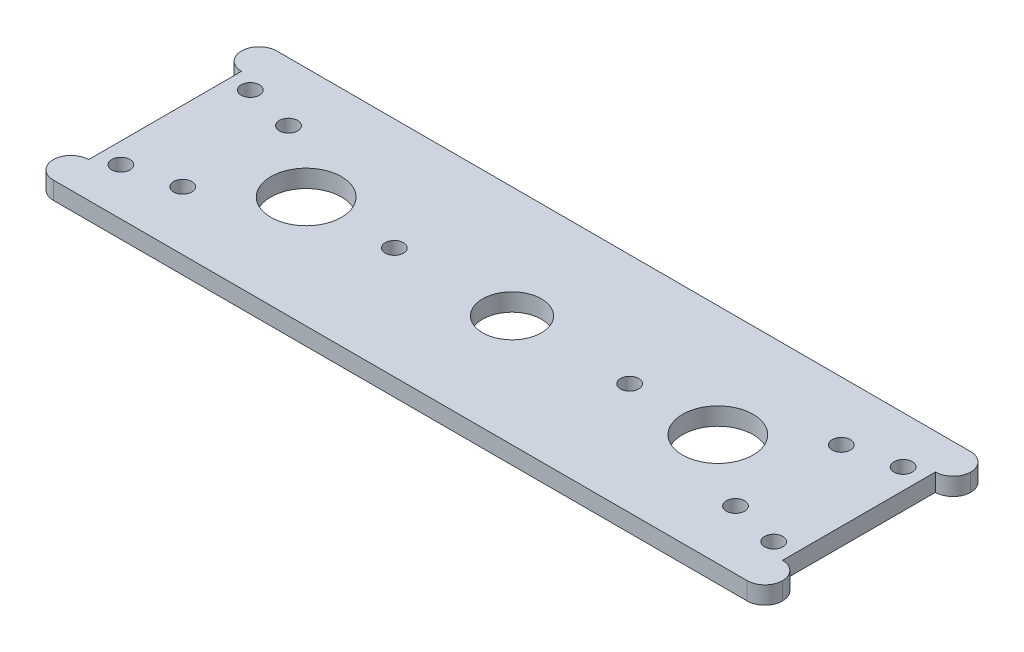
from build123d import *

# Parameters (mm, degrees)
SKETCH1_R           = 1.55
SKETCH1_R_2         = 5
SKETCH1_R_3         = 6
BOSS_EXTRUDE1_DEPTH = 3
FILLET1_R           = 3


with BuildPart() as part:
    # Sketch1 → Boss-Extrude1 (new body)
    with BuildSketch(Plane(origin=(0, 0, 0), x_dir=(1, 0, 0), z_dir=(0, 1, 0))):
        Polygon((-62, 19), (62, 19), (62, 13), (59, 13), (59, -13), (62, -13), (62, -19), (-62, -19), (-62, -13), (-59, -13), (-59, 13), (-62, 13), align=None)
        with Locations(Location((55.5, 11, 0), (0, 0, 270))):
            Circle(SKETCH1_R, mode=Mode.SUBTRACT)
        with Locations(Location((-55.5, 11, 0), (0, 0, 90))):
            Circle(SKETCH1_R, mode=Mode.SUBTRACT)
        with Locations(Location((-55.5, -11, 0), (0, 0, 270))):
            Circle(SKETCH1_R, mode=Mode.SUBTRACT)
        with Locations(Location((55.5, -11, 0), (0, 0, 90))):
            Circle(SKETCH1_R, mode=Mode.SUBTRACT)
        with Locations(Location((0, 0, 0), (0, 0, 270))):
            Circle(SKETCH1_R_2, mode=Mode.SUBTRACT)
        with Locations(Location((20, 0, 0), (0, 0, 270))):
            Circle(SKETCH1_R, mode=Mode.SUBTRACT)
        with Locations(Location((-20, 0, 0), (0, 0, 90))):
            Circle(SKETCH1_R, mode=Mode.SUBTRACT)
        with Locations(Location((35, 0, 0), (0, 0, 270))):
            Circle(SKETCH1_R_3, mode=Mode.SUBTRACT)
        with Locations(Location((-35, 0, 0), (0, 0, 90))):
            Circle(SKETCH1_R_3, mode=Mode.SUBTRACT)
        with Locations(Location((47, 9, 0), (0, 0, 270))):
            Circle(SKETCH1_R, mode=Mode.SUBTRACT)
        with Locations(Location((47, -9, 0), (0, 0, 90))):
            Circle(SKETCH1_R, mode=Mode.SUBTRACT)
        with Locations(Location((-47, -9, 0), (0, 0, 270))):
            Circle(SKETCH1_R, mode=Mode.SUBTRACT)
        with Locations(Location((-47, 9, 0), (0, 0, 90))):
            Circle(SKETCH1_R, mode=Mode.SUBTRACT)
    extrude(amount=BOSS_EXTRUDE1_DEPTH)

    # Fillet1
    fillet1_edges = [part.edges().sort_by_distance(p)[0] for p in [
        (-62, 1.5, -19),
        (-62, 1.5, -13),
        (-62, 1.5, 13),
        (-62, 1.5, 19),
        (62, 1.5, 19),
        (62, 1.5, 13),
        (62, 1.5, -13),
        (62, 1.5, -19),
    ]]
    fillet(fillet1_edges, radius=FILLET1_R - 0.0001)  # a hair under: the kernel refuses the full size


solid = part.part
